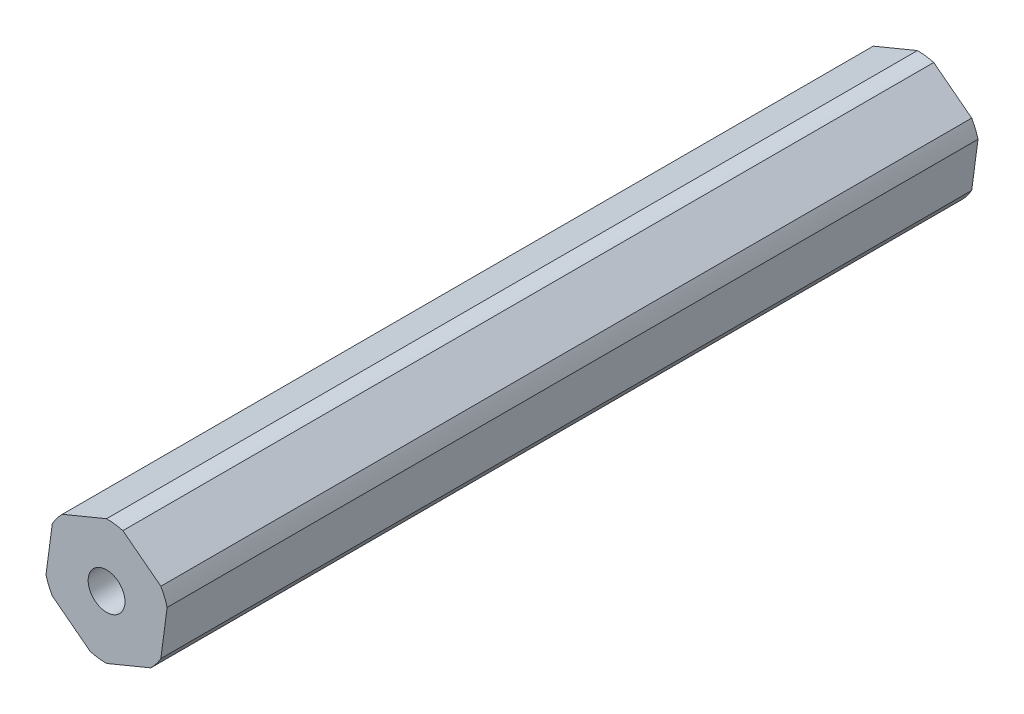
from build123d import *

# Parameters (mm, degrees)
BOSS_EXTRUDE1_DEPTH        = 88.9
F_10_32_TAPPED_HOLE1_D     = 4.0386
F_10_32_TAPPED_HOLE1_DEPTH = 12.0396
F_10_32_TAPPED_HOLE1_TIP   = 1.213317848
F_10_32_TAPPED_HOLE2_D     = 4.0386
F_10_32_TAPPED_HOLE2_DEPTH = 12.0396
F_10_32_TAPPED_HOLE2_TIP   = 1.213317848


with BuildPart() as part:
    # Sketch1 → Boss-Extrude1 (new body)
    with BuildSketch(Plane.XY):
        with BuildLine():
            Line((5.950200742, 3.43535), (1.789892893, 6.63346078))
            ThreePointArc((1.789892893, 6.63346078), (0.902773368, 6.811131972), (0, 6.8707))
            Line((0, 6.8707), (-4.849799104, 4.866823105))
            ThreePointArc((-4.849799104, 4.866823105), (-5.447226632, 4.187390656), (-5.950200742, 3.43535))
            Line((-5.950200742, 3.43535), (-6.639691997, -1.766637675))
            ThreePointArc((-6.639691997, -1.766637675), (-6.35, -2.623741315), (-5.950200742, -3.43535))
            Line((-5.950200742, -3.43535), (-1.789892893, -6.63346078))
            ThreePointArc((-1.789892893, -6.63346078), (-0.902773368, -6.811131972), (0, -6.8707))
            Line((0, -6.8707), (4.849799104, -4.866823105))
            ThreePointArc((4.849799104, -4.866823105), (5.447226632, -4.187390656), (5.950200742, -3.43535))
            Line((5.950200742, -3.43535), (6.639691997, 1.766637675))
            ThreePointArc((6.639691997, 1.766637675), (6.35, 2.623741315), (5.950200742, 3.43535))
        make_face()
    extrude(amount=BOSS_EXTRUDE1_DEPTH)

    # #10-32 Tapped Hole1
    with Locations(Plane.XY.offset(88.9)):
        with Locations((0, 0)):
            Hole(F_10_32_TAPPED_HOLE1_D / 2, depth=F_10_32_TAPPED_HOLE1_DEPTH)
            with Locations((0, 0, -(F_10_32_TAPPED_HOLE1_DEPTH + F_10_32_TAPPED_HOLE1_TIP / 2))):  # 118° drill point
                Cone(0, F_10_32_TAPPED_HOLE1_D / 2, F_10_32_TAPPED_HOLE1_TIP, mode=Mode.SUBTRACT)

    # #10-32 Tapped Hole2
    with Locations(Plane(origin=(0, 0, 0), x_dir=(-1, 0, 0), z_dir=(0, 0, -1))):
        with Locations((0, 0)):
            Hole(F_10_32_TAPPED_HOLE2_D / 2, depth=F_10_32_TAPPED_HOLE2_DEPTH)
            with Locations((0, 0, -(F_10_32_TAPPED_HOLE2_DEPTH + F_10_32_TAPPED_HOLE2_TIP / 2))):  # 118° drill point
                Cone(0, F_10_32_TAPPED_HOLE2_D / 2, F_10_32_TAPPED_HOLE2_TIP, mode=Mode.SUBTRACT)


solid = part.part
